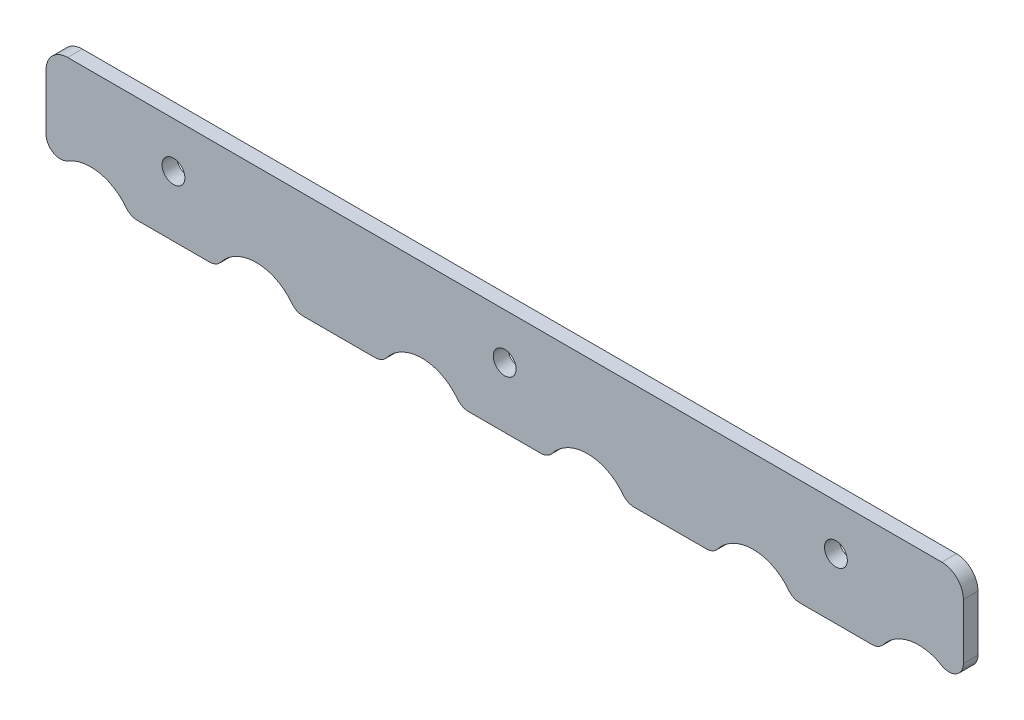
from build123d import *

# Parameters (mm, degrees)
BOSS_EXTRUDE1_DEPTH = 2.032
FILLET1_R           = 3
FILLET2_R           = 2
SKETCH4_R           = 1.5875
CUT_EXTRUDE1_DEPTH  = 136.039904867


with BuildPart() as part:
    # Sketch3 → Boss-Extrude1 (new body)
    with BuildSketch(Plane.XY):
        with BuildLine():
            ThreePointArc((4.575, 10.775), (9.225864227, 16.778347263), (16.200863987, 13.775))
            Line((16.200863987, 13.775), (28.349136013, 13.775))
            ThreePointArc((28.349136013, 13.775), (33.775, 16.975), (39.200863987, 13.775))
            Line((39.200863987, 13.775), (51.349136013, 13.775))
            ThreePointArc((51.349136013, 13.775), (56.775, 16.975), (62.200863987, 13.775))
            Line((62.200863987, 13.775), (74.349136013, 13.775))
            ThreePointArc((74.349136013, 13.775), (79.775, 16.975), (85.200863987, 13.775))
            Line((85.200863987, 13.775), (97.349136013, 13.775))
            ThreePointArc((97.349136013, 13.775), (102.775, 16.975), (108.200863987, 13.775))
            Line((108.200863987, 13.775), (120.349136013, 13.775))
            ThreePointArc((120.349136013, 13.775), (127.324135773, 16.778347263), (131.975, 10.775))
            Line((131.975, 10.775), (131.975, 28.535))
            Line((131.975, 28.535), (4.575, 28.535))
            Line((4.575, 28.535), (4.575, 10.775))
        make_face()
    extrude(amount=BOSS_EXTRUDE1_DEPTH)

    # Fillet1
    fillet1_edges = [part.edges().sort_by_distance(p)[0] for p in [
        (4.575, 28.535, 1.016),
        (131.975, 28.535, 1.016),
    ]]
    fillet(fillet1_edges, radius=FILLET1_R)

    # Fillet2
    fillet2_edges = [part.edges().sort_by_distance(p)[0] for p in [
        (120.349136013, 13.775, 1.016),
    ]]
    fillet(fillet2_edges, radius=FILLET2_R)
    fillet2_2_edges = [part.edges().sort_by_distance(p)[0] for p in [
        (108.200863987, 13.775, 1.016),
    ]]
    fillet(fillet2_2_edges, radius=FILLET2_R)
    fillet2_3_edges = [part.edges().sort_by_distance(p)[0] for p in [
        (97.349136013, 13.775, 1.016),
    ]]
    fillet(fillet2_3_edges, radius=FILLET2_R)
    fillet2_4_edges = [part.edges().sort_by_distance(p)[0] for p in [
        (4.575, 10.775, 1.016),
    ]]
    fillet(fillet2_4_edges, radius=FILLET2_R)
    fillet2_5_edges = [part.edges().sort_by_distance(p)[0] for p in [
        (85.200863987, 13.775, 1.016),
    ]]
    fillet(fillet2_5_edges, radius=FILLET2_R)
    fillet2_6_edges = [part.edges().sort_by_distance(p)[0] for p in [
        (16.200863987, 13.775, 1.016),
    ]]
    fillet(fillet2_6_edges, radius=FILLET2_R)
    fillet2_7_edges = [part.edges().sort_by_distance(p)[0] for p in [
        (74.349136013, 13.775, 1.016),
    ]]
    fillet(fillet2_7_edges, radius=FILLET2_R)
    fillet2_8_edges = [part.edges().sort_by_distance(p)[0] for p in [
        (28.349136013, 13.775, 1.016),
    ]]
    fillet(fillet2_8_edges, radius=FILLET2_R)
    fillet2_9_edges = [part.edges().sort_by_distance(p)[0] for p in [
        (62.200863987, 13.775, 1.016),
    ]]
    fillet(fillet2_9_edges, radius=FILLET2_R)
    fillet2_10_edges = [part.edges().sort_by_distance(p)[0] for p in [
        (39.200863987, 13.775, 1.016),
    ]]
    fillet(fillet2_10_edges, radius=FILLET2_R)
    fillet2_11_edges = [part.edges().sort_by_distance(p)[0] for p in [
        (51.349136013, 13.775, 1.016),
    ]]
    fillet(fillet2_11_edges, radius=FILLET2_R)
    fillet2_12_edges = [part.edges().sort_by_distance(p)[0] for p in [
        (131.975, 10.775, 1.016),
    ]]
    fillet(fillet2_12_edges, radius=FILLET2_R)

    # Sketch4 → Cut-Extrude1 (cut, through all)
    with BuildSketch(Plane(origin=(0, 0, 0), x_dir=(-1, 0, 0), z_dir=(0, 0, -1))):
        with Locations((-22.275, 22.185)):
            Circle(SKETCH4_R)
        with Locations((-68.275, 22.185)):
            Circle(SKETCH4_R)
        with Locations((-114.275, 22.185)):
            Circle(SKETCH4_R)
    extrude(amount=-CUT_EXTRUDE1_DEPTH, mode=Mode.SUBTRACT)


solid = part.part
